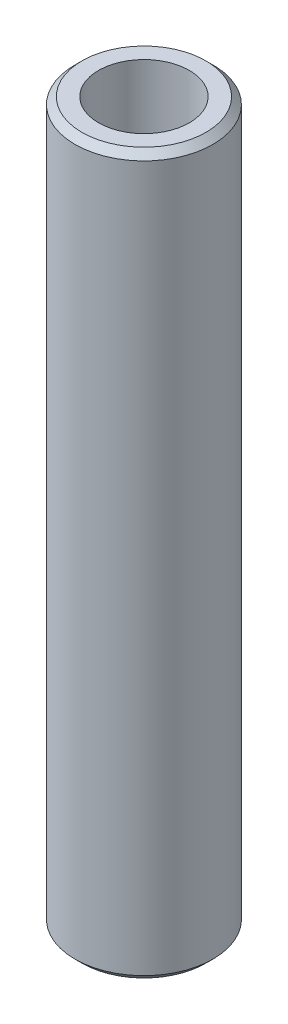
from build123d import *

# Parameters (mm, degrees)
SKETCH1_R           = 57.5
BOSS_EXTRUDE1_DEPTH = 600
SKETCH2_R           = 37.863586802
CUT_EXTRUDE1_DEPTH  = 606.485342515
CHAMFER1_SIZE       = 5.808059527


with BuildPart() as part:
    # Sketch1 → Boss-Extrude1 (new body)
    with BuildSketch(Plane(origin=(0, 0, 0), x_dir=(1, 0, 0), z_dir=(0, 1, 0))):
        Circle(SKETCH1_R)
    extrude(amount=BOSS_EXTRUDE1_DEPTH)

    # Sketch2 → Cut-Extrude1 (cut, through all)
    with BuildSketch(Plane(origin=(0, 0, 0), x_dir=(1, 0, 0), z_dir=(0, 1, 0))):
        Circle(SKETCH2_R)
    extrude(amount=CUT_EXTRUDE1_DEPTH, mode=Mode.SUBTRACT)

    # Chamfer1
    chamfer1_edges = [part.edges().sort_by_distance(p)[0] for p in [
        (-57.5, 600, 0),
        (-57.5, 0, 0),
    ]]
    chamfer(chamfer1_edges, length=CHAMFER1_SIZE)


solid = part.part
